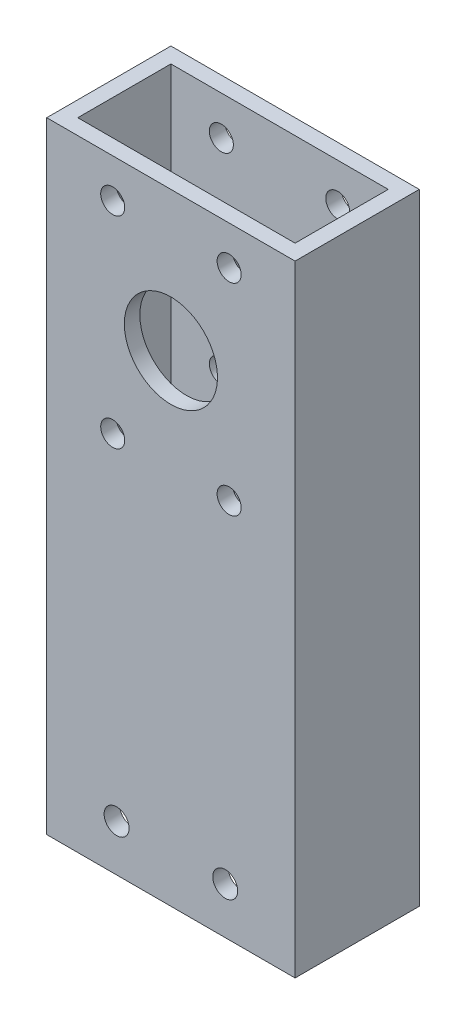
from build123d import *

# Parameters (mm, degrees)
SKETCH1_W                    = 50.8
SKETCH1_H                    = 25.4
SKETCH1_W_2                  = 44.45
SKETCH1_H_2                  = 19.05
EXTRUDE_THIN1_DEPTH          = 127
F_10_0_1935_DIAMETER_HOLE2_D = 4.9149
CUT_EXTRUDE2_DEPTH           = 132.982271537
CUT_EXTRUDE2_DEPTH_BACK      = 132.982271537
SKETCH7_R                    = 9.525
F_1_4_20_TAPPED_HOLE1_D      = 5.1054


with BuildPart() as part:
    # Sketch1 → Extrude-Thin1 (new body)
    with BuildSketch(Plane(origin=(0, 0, 0), x_dir=(1, 0, 0), z_dir=(0, 1, 0))):
        Rectangle(SKETCH1_W, SKETCH1_H)
        Rectangle(SKETCH1_W_2, SKETCH1_H_2, mode=Mode.SUBTRACT)
    extrude(amount=EXTRUDE_THIN1_DEPTH)

    # #10 (0.1935) Diameter Hole2 (through all)
    with Locations(Plane(origin=(0, 0, -12.7), x_dir=(-1, 0, 0), z_dir=(0, 0, -1))):
        with Locations((-11.90625, 77.802770072), (-11.90625, 119.047229928), (11.90625, 119.047229928), (11.90625, 77.802770072)):
            Hole(F_10_0_1935_DIAMETER_HOLE2_D / 2)

    # Sketch7 → Cut-Extrude2 (cut, two sides: drawn at the far end of the back side and taken through both)
    with BuildSketch(Plane(origin=(0, 0, -12.7), x_dir=(-1, 0, 0), z_dir=(0, 0, -1)).offset(-CUT_EXTRUDE2_DEPTH_BACK)):
        with Locations((0, 98.425)):
            Circle(SKETCH7_R)
    extrude(amount=CUT_EXTRUDE2_DEPTH + CUT_EXTRUDE2_DEPTH_BACK, mode=Mode.SUBTRACT)

    # 1/4-20 Tapped Hole1 (through all)
    with Locations(Plane.XY.offset(12.7)):
        with Locations((-11.1125, 9.525), (11.1125, 9.525), (-109.171479686, 68.785430569)):
            Hole(F_1_4_20_TAPPED_HOLE1_D / 2)


solid = part.part
